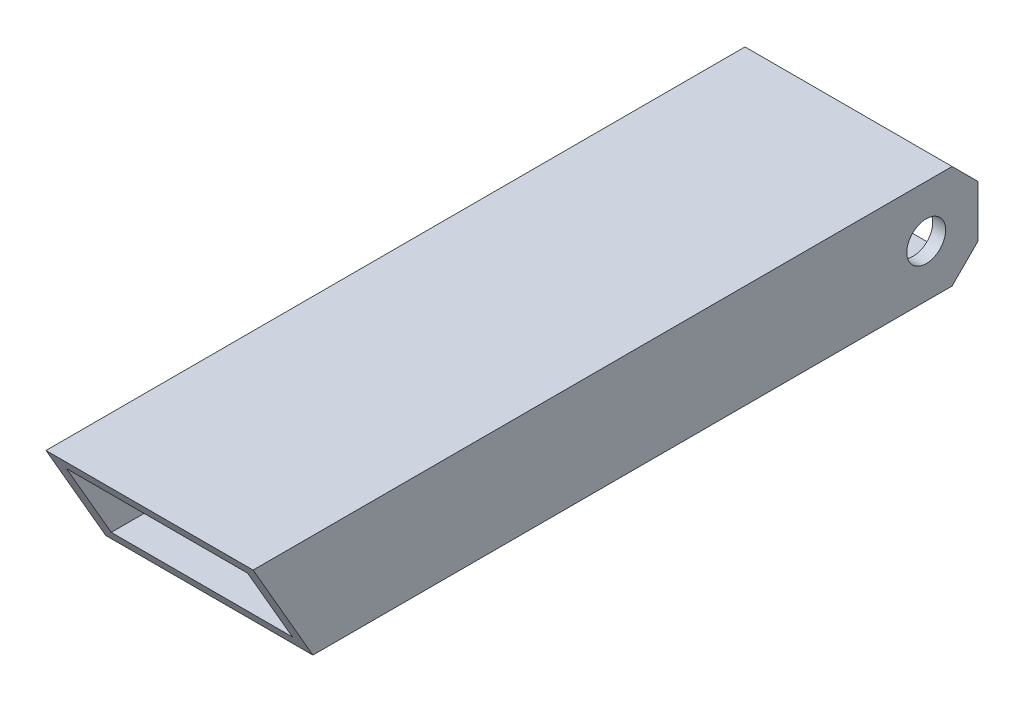
from build123d import *

# Parameters (mm, degrees)
SKETCH1_W           = 50.8
SKETCH1_H           = 25.4
SKETCH1_W_2         = 44.45
SKETCH1_H_2         = 19.05
BOSS_EXTRUDE1_DEPTH = 177.8
CUT_EXTRUDE1_DEPTH  = 186.350397895
SKETCH3_R           = 4.7625
CUT_EXTRUDE2_DEPTH  = 186.350397895
CUT_EXTRUDE3_DEPTH  = 186.350397895


with BuildPart() as part:
    # Sketch1 → Boss-Extrude1 (new body)
    with BuildSketch(Plane.XY):
        Rectangle(SKETCH1_W, SKETCH1_H)
        Rectangle(SKETCH1_W_2, SKETCH1_H_2, mode=Mode.SUBTRACT)
    extrude(amount=BOSS_EXTRUDE1_DEPTH)

    # Sketch2 → Cut-Extrude1 (cut, through all)
    with BuildSketch(Plane(origin=(25.4, 0, 0), x_dir=(0, 0, -1), z_dir=(1, 0, 0))):
        Polygon((-177.8, 12.7), (-163.135303163, -12.7), (-177.8, -12.7), align=None)
    extrude(amount=-CUT_EXTRUDE1_DEPTH, mode=Mode.SUBTRACT)

    # Sketch3 → Cut-Extrude2 (cut, through all)
    with BuildSketch(Plane(origin=(25.4, 0, 0), x_dir=(0, 0, -1), z_dir=(1, 0, 0))):
        with Locations((-12.7, 0)):
            Circle(SKETCH3_R)
    extrude(amount=-CUT_EXTRUDE2_DEPTH, mode=Mode.SUBTRACT)

    # Sketch4 → Cut-Extrude3 (cut, through all)
    with BuildSketch(Plane(origin=(25.4, 0, 0), x_dir=(0, 0, -1), z_dir=(1, 0, 0))):
        Polygon((-6.35, 12.7), (0, 6.35), (0, 12.7), align=None)
        Polygon((0, -12.7), (-6.35, -12.7), (0, -6.35), align=None)
    extrude(amount=-CUT_EXTRUDE3_DEPTH, mode=Mode.SUBTRACT)


solid = part.part
